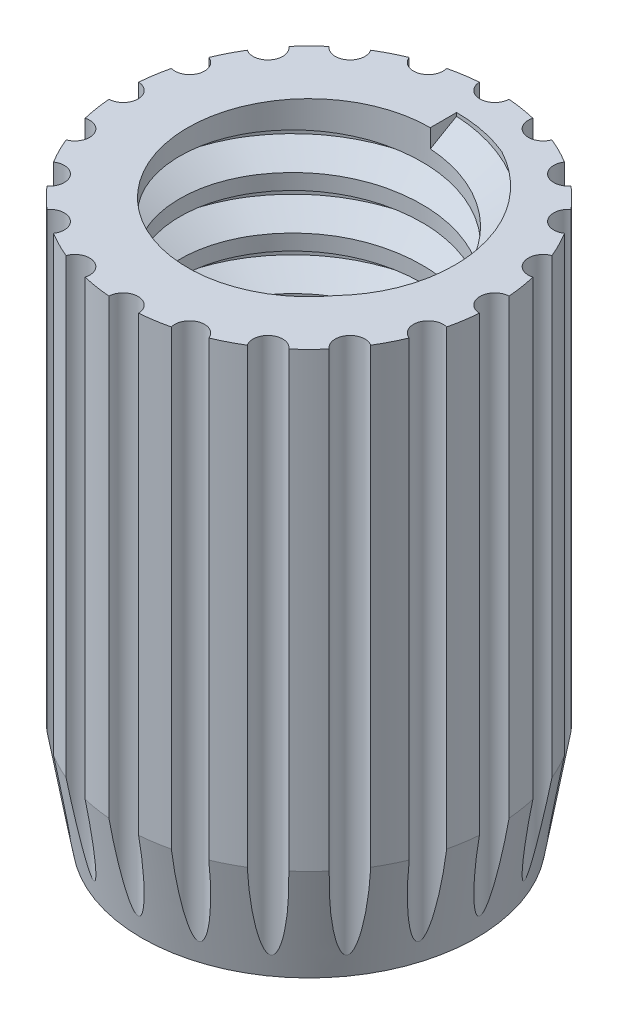
from build123d import *

# Parameters (mm, degrees)
SKETCH1_R                    = 5
BOSS_EXTRUDE1_DEPTH          = 15
F_5_16_18_TAPPED_HOLE1_D     = 6.5278
F_5_16_18_TAPPED_HOLE1_DEPTH = 10
F_5_16_18_TAPPED_HOLE1_TIP   = 1.961148974
CHAMFER1_SIZE                = 0.5
CHAMFER1_SIZE2               = 2.83564091
SKETCH5_R                    = 0.4
CUT_EXTRUDE2_DEPTH           = 17.583123952
CUT_SWEEP6_PITCH             = 1.411111111


# Read off the part's stored shape, not the designer's step: Cut-Loft1
with BuildPart() as part:
    # Sketch1 → Boss-Extrude1 (new body)
    with BuildSketch(Plane(origin=(0, 0, 0), x_dir=(1, 0, 0), z_dir=(0, 1, 0))):
        with Locations(Location((0, 0, 0), (0, 0, 270))):
            Circle(SKETCH1_R)
    extrude(amount=BOSS_EXTRUDE1_DEPTH)

    # 5/16-18 Tapped Hole1
    with Locations(Plane(origin=(0, 15, 0), x_dir=(1, 0, 0), z_dir=(0, 1, 0))):
        with Locations((0, 0)):
            Hole(F_5_16_18_TAPPED_HOLE1_D / 2, depth=F_5_16_18_TAPPED_HOLE1_DEPTH)
            with Locations((0, 0, -(F_5_16_18_TAPPED_HOLE1_DEPTH + F_5_16_18_TAPPED_HOLE1_TIP / 2))):  # 118° drill point
                Cone(0, F_5_16_18_TAPPED_HOLE1_D / 2, F_5_16_18_TAPPED_HOLE1_TIP, mode=Mode.SUBTRACT)

    # Cut-Loft1 outline → Cut-Loft1 (revolve, cut)
    with BuildSketch(Plane.XY):
        Polygon((2.5, 0), (3.2639, 5), (0, 3.038851026), (0, 0), align=None)
    revolve(axis=Axis((0, 0, 0), (0, 1, 0)), mode=Mode.SUBTRACT)

    # Chamfer1
    chamfer1_edges = [part.edges().sort_by_distance(p)[0] for p in [
        (0, 0, -5),
    ]]
    chamfer1_side = [part.faces().sort_by_distance(p)[0] for p in [
        (0, 0, -4.858578644),
    ]]
    chamfer(chamfer1_edges, length=CHAMFER1_SIZE, length2=CHAMFER1_SIZE2, reference=chamfer1_side[0])

    # Sketch5 → Cut-Extrude2 (cut, through all)
    with BuildSketch(Plane(origin=(0, 15, 0), x_dir=(1, 0, 0), z_dir=(0, 1, 0))):
        with Locations((0, 5)):
            Circle(SKETCH5_R)
        with Locations((1.545084972, 4.755282581)):
            Circle(SKETCH5_R)
        with Locations((2.938926261, 4.045084972)):
            Circle(SKETCH5_R)
        with Locations((4.045084972, 2.938926261)):
            Circle(SKETCH5_R)
        with Locations((4.755282581, 1.545084972)):
            Circle(SKETCH5_R)
        with Locations((5, 0)):
            Circle(SKETCH5_R)
        with Locations((4.755282581, -1.545084972)):
            Circle(SKETCH5_R)
        with Locations((4.045084972, -2.938926261)):
            Circle(SKETCH5_R)
        with Locations((2.938926261, -4.045084972)):
            Circle(SKETCH5_R)
        with Locations((1.545084972, -4.755282581)):
            Circle(SKETCH5_R)
        with Locations((0, -5)):
            Circle(SKETCH5_R)
        with Locations((-1.545084972, -4.755282581)):
            Circle(SKETCH5_R)
        with Locations((-2.938926261, -4.045084972)):
            Circle(SKETCH5_R)
        with Locations((-4.045084972, -2.938926261)):
            Circle(SKETCH5_R)
        with Locations((-4.755282581, -1.545084972)):
            Circle(SKETCH5_R)
        with Locations((-5, 0)):
            Circle(SKETCH5_R)
        with Locations((-4.755282581, 1.545084972)):
            Circle(SKETCH5_R)
        with Locations((-4.045084972, 2.938926261)):
            Circle(SKETCH5_R)
        with Locations((-2.938926261, 4.045084972)):
            Circle(SKETCH5_R)
        with Locations((-1.545084972, 4.755282581)):
            Circle(SKETCH5_R)
    extrude(amount=-CUT_EXTRUDE2_DEPTH, mode=Mode.SUBTRACT)

    # Cut-Sweep6: the profile of Sketch8 screwed along a right-hand helix of 8 turns, 8 arcs to a turn; built about Z, then put on its axis
    cut_sweep6_z = Axis((0, 0, 0), (0, 0, 1))
    cut_sweep6_corners = [(3.10261, 0, -0.941760072), (3.10261, 0, -0.588982294), (3.97, 0, -0.088194444), (3.97, 0, 0.088194444), (3.10261, 0, 0.588982294), (1.743048098, 0, 0.588982294), (1.743048098, 0, -0.941760072)]
    with BuildLine(mode=Mode.PRIVATE) as cut_sweep6_profile:
        Line(cut_sweep6_corners[0], cut_sweep6_corners[1])
        Line(cut_sweep6_corners[1], cut_sweep6_corners[2])
        Line(cut_sweep6_corners[2], cut_sweep6_corners[3])
        Line(cut_sweep6_corners[3], cut_sweep6_corners[4])
        Line(cut_sweep6_corners[4], cut_sweep6_corners[5])
        Line(cut_sweep6_corners[5], cut_sweep6_corners[6])
        Line(cut_sweep6_corners[6], cut_sweep6_corners[0])
    cut_sweep6_cap = Face(cut_sweep6_profile.wire())
    cut_sweep6_turn_angles = [0, 22.5, 45, 67.5, 90, 112.5, 135, 157.5, 180, 202.5, 225, 247.5, 270, 292.5, 315, 337.5, 360]
    cut_sweep6_turn_weights = [1, 0.9238795325112867, 1, 0.9238795325112867, 1, 0.9238795325112867, 1, 0.9238795325112867, 1, 0.9238795325112867, 1, 0.9238795325112867, 1, 0.9238795325112867, 1, 0.9238795325112867, 1]
    cut_sweep6_turn_rails = [Edge.make_bspline([Vector(p[0], p[1], 0).rotate(cut_sweep6_z, cut_sweep6_turn_angles[k]) / cut_sweep6_turn_weights[k] + Vector(0, 0, p[2] + CUT_SWEEP6_PITCH * cut_sweep6_turn_angles[k] / 360) for k in range(17)], [0, 0, 0, 1, 1, 2, 2, 3, 3, 4, 4, 5, 5, 6, 6, 7, 7, 8, 8, 8], 2, cut_sweep6_turn_weights) for p in cut_sweep6_corners]
    cut_sweep6_turn_sides = [Face.make_surface_from_curves(cut_sweep6_turn_rails[p[0]], cut_sweep6_turn_rails[p[1]]) for p in [(0, 1), (1, 2), (2, 3), (3, 4), (4, 5), (5, 6), (6, 0)]]
    cut_sweep6 = Plane(origin=(0, 15, 0), x_dir=(0, 0, -1), z_dir=(0, -1, 0)) * Solid(Shell([*[p.moved(Location((0, 0, CUT_SWEEP6_PITCH * i))) for i in range(8) for p in cut_sweep6_turn_sides], cut_sweep6_cap, cut_sweep6_cap.rotate(cut_sweep6_z, 2880).moved(Location((0, 0, CUT_SWEEP6_PITCH * 2880 / 360)))]))
    add(cut_sweep6, mode=Mode.SUBTRACT)


solid = part.part
